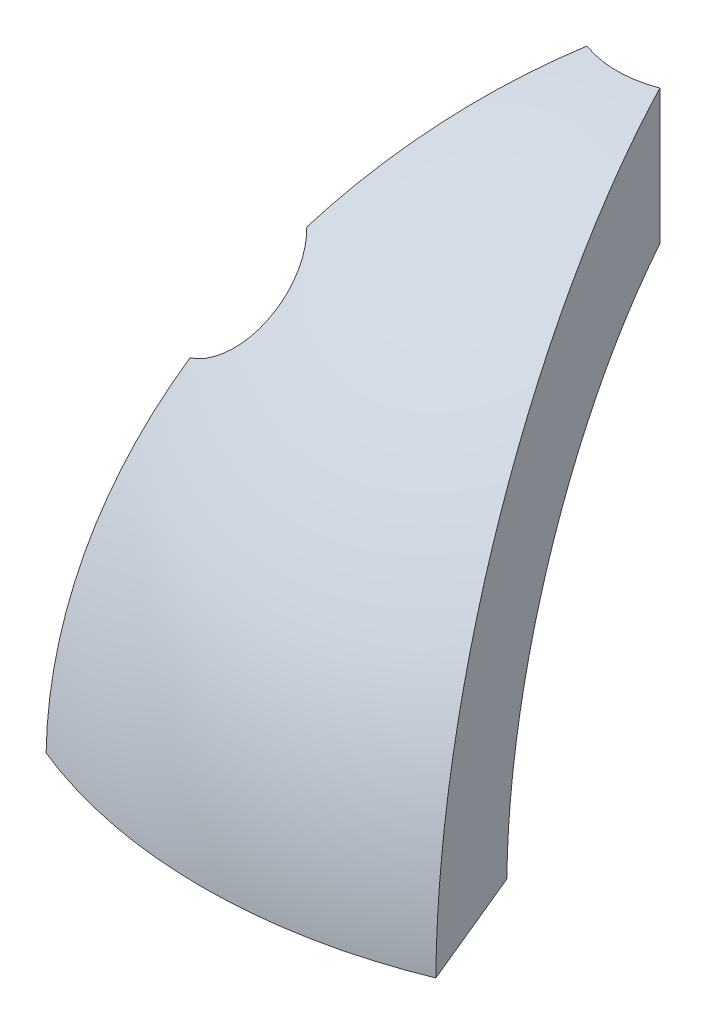
from build123d import *

# Parameters (mm, degrees)
REVOLVE1_ANGLE          = 45
CUT_EXTRUDE1_DEPTH      = 28.647117169
CUT_EXTRUDE1_DEPTH_BACK = 28.647117169
CUT_EXTRUDE4_START      = 8.537277035
CUT_EXTRUDE4_DEPTH      = 5.473576564
CUT_EXTRUDE4_START_2    = 14.010853599
CUT_EXTRUDE4_2_DEPTH    = 0.589178544
CUT_EXTRUDE5_DEPTH      = 28.732730484
CUT_EXTRUDE5_DEPTH_BACK = 28.732730484
SKETCH9_R               = 2.6035


with BuildPart() as part:
    # Sketch1 → Revolve1 (revolve, symmetric)
    with BuildSketch(Plane(origin=(0, 0, 0), x_dir=(0, 0, -1), z_dir=(1, 0, 0))) as revolve1_sk:
        with BuildLine():
            Line((-14.217802221, 0.25), (-19.048359509, 0.25))
            ThreePointArc((-19.048359509, 0.25), (-14.676690222, 12.144845166), (-3.81, 18.66511184))
            Line((-3.81, 18.66511184), (-3.81, 13.700083941))
            ThreePointArc((-3.81, 13.700083941), (-11.246181696, 8.70240181), (-14.217802221, 0.25))
        make_face()
    revolve(axis=Axis((0, 0, 0), (0, 1, 0)), revolution_arc=REVOLVE1_ANGLE / 2)
    revolve(revolve1_sk.sketch, axis=Axis((0, 0, 0), (0, -1, 0)), revolution_arc=REVOLVE1_ANGLE / 2)

    # Sketch2 → Cut-Extrude1 (cut, two sides: drawn at the far end of the back side and taken through both)
    with BuildSketch(Plane(origin=(0, 0, 0), x_dir=(1, 0, 0), z_dir=(0, 1, 0)).offset(-CUT_EXTRUDE1_DEPTH_BACK)):
        with BuildLine():
            Line((7.289491598, -17.598389479), (1.458023877, -3.519981019))
            ThreePointArc((1.458023877, -3.519981019), (1.400077392, -3.543428184), (1.341754023, -3.5659215))
            Line((1.341754023, -3.5659215), (7.173849701, -17.645845983))
            ThreePointArc((7.173849701, -17.645845983), (7.231709577, -17.622212591), (7.289491598, -17.598389479))
        make_face()
        with BuildLine():
            Line((-7.173849701, -17.645845983), (-1.341754023, -3.5659215))
            ThreePointArc((-1.341754023, -3.5659215), (-1.400077392, -3.543428184), (-1.458023877, -3.519981019))
            Line((-1.458023877, -3.519981019), (-7.289491598, -17.598389479))
            ThreePointArc((-7.289491598, -17.598389479), (-7.231709577, -17.622212591), (-7.173849701, -17.645845983))
        make_face()
    extrude(amount=CUT_EXTRUDE1_DEPTH + CUT_EXTRUDE1_DEPTH_BACK, mode=Mode.SUBTRACT)

    # Cut-Extrude4: read off the stored shape, not the designer's step
    # Cut-Extrude4 outline → Cut-Extrude4 (cut)
    with BuildSketch(Plane(origin=(0, 0, 0), x_dir=(-1, 0, 0), z_dir=(0, 0.3826834323650899, 0.9238795325112868)).offset(CUT_EXTRUDE4_START)):
        with BuildLine():
            add(Edge.make_bspline(
                [(1.145086138, 3.565969106), (1.19745992, 3.501753358), (1.247244242, 3.434878944), (1.289054738, 3.363552137), (1.36987604, 3.225674665), (1.42881214, 3.072360327), (1.457196317, 2.91577175), (1.47334903, 2.826661179), (1.4796055, 2.735818699), (1.481666667, 2.645269988)],
                knots=[0, 0, 0, 0, 0.246790042, 0.246790042, 0.246790042, 0.728901446, 0.728901446, 0.728901446, 1, 1, 1, 1], degree=3))
            add(Edge.make_bspline(
                [(-0.034726562, 4.053921831), (0.07575388, 4.051019144), (0.186778995, 4.046395579), (0.295874255, 4.028901651), (0.467443739, 4.001389693), (0.637906375, 3.946400478), (0.789002935, 3.861831747), (0.924097327, 3.786219427), (1.04145298, 3.67986749), (1.145086138, 3.565969106)],
                knots=[0, 0, 0, 0, 0.249295942, 0.249295942, 0.249295942, 0.645680683, 0.645680683, 0.645680683, 1, 1, 1, 1], degree=3))
            add(Edge.make_bspline(
                [(-1.538653846, 2.681777399), (-1.533984641, 2.841390676), (-1.509995079, 3.003784016), (-1.452444081, 3.153169647), (-1.394735889, 3.302963304), (-1.308458263, 3.44367736), (-1.206069907, 3.568297055), (-1.117554458, 3.676031652), (-1.011064819, 3.772567587), (-0.891455892, 3.845919508), (-0.771642392, 3.919396885), (-0.636486792, 3.970759294), (-0.499275438, 4.003497061), (-0.34783736, 4.039629235), (-0.190448958, 4.050094147), (-0.034726562, 4.053921831)],
                knots=[0, 0, 0, 0, 0.213488165, 0.213488165, 0.213488165, 0.426876737, 0.426876737, 0.426876737, 0.611615857, 0.611615857, 0.611615857, 0.79654204, 0.79654204, 0.79654204, 1, 1, 1, 1], degree=3))
            add(Edge.make_bspline(
                [(-0.661585537, 1.463676438), (-0.899774904, 1.586484198), (-1.128226559, 1.734488753), (-1.451046171, 2.153494958), (-1.532392107, 2.415727364), (-1.538653846, 2.681777399)],
                knots=[0, 0, 0, 0, 0.5, 0.5, 1, 1, 1, 1], degree=3))
            add(Edge.make_bspline(
                [(-1.310705128, 0.521607127), (-1.305904516, 0.65367332), (-1.280862157, 0.788593254), (-1.226377368, 0.909035745), (-1.178829711, 1.014143213), (-1.111903507, 1.112084922), (-1.032368876, 1.195678848), (-0.952782866, 1.279326774), (-0.859002662, 1.350529079), (-0.759375758, 1.408896603), (-0.727137868, 1.427783528), (-0.694356407, 1.445732495), (-0.661585537, 1.463676438)],
                knots=[0, 0, 0, 0, 0.332551925, 0.332551925, 0.332551925, 0.620515921, 0.620515921, 0.620515921, 0.907833434, 0.907833434, 0.907833434, 1, 1, 1, 1], degree=3))
            add(Edge.make_bspline(
                [(-0.008013822, -0.619026887), (-0.329093033, -0.609182757), (-0.647556074, -0.51508889), (-1.142511109, -0.108023215), (-1.296474915, 0.197661831), (-1.310705128, 0.521607127)],
                knots=[0, 0, 0, 0, 0.5, 0.5, 1, 1, 1, 1], degree=3))
            add(Edge.make_bspline(
                [(1.253717949, 0.534073073), (1.248106847, 0.402186726), (1.226592659, 0.268072734), (1.177956097, 0.145346109), (1.129145328, 0.022179899), (1.058406248, -0.094576574), (0.970426594, -0.19366506), (0.885346609, -0.289487746), (0.783549843, -0.372494682), (0.672886827, -0.437179025), (0.555024512, -0.506071477), (0.425013252, -0.557408464), (0.291775846, -0.587329089), (0.19373517, -0.609345716), (0.092421842, -0.615777022), (-0.008013822, -0.619026887)],
                knots=[0, 0, 0, 0, 0.21068445, 0.21068445, 0.21068445, 0.421636468, 0.421636468, 0.421636468, 0.625019757, 0.625019757, 0.625019757, 0.841526684, 0.841526684, 0.841526684, 1, 1, 1, 1], degree=3))
            add(Edge.make_bspline(
                [(0.622406851, 1.463676438), (0.794872438, 1.366288738), (0.958485385, 1.250710522), (1.193364369, 0.930775301), (1.246147584, 0.733258349), (1.253717949, 0.534073073)],
                knots=[0, 0, 0, 0, 0.5, 0.5, 1, 1, 1, 1], degree=3))
            add(Edge.make_bspline(
                [(1.481666667, 2.645269988), (1.477900568, 2.506257325), (1.458307011, 2.364648218), (1.409828968, 2.234085494), (1.360959813, 2.102469417), (1.284712252, 1.978252529), (1.189539786, 1.874109185), (1.068614249, 1.741785305), (0.920513154, 1.632246696), (0.764629517, 1.541288113), (0.718017874, 1.514090075), (0.670244168, 1.488815415), (0.622406851, 1.463676438)],
                knots=[0, 0, 0, 0, 0.272687597, 0.272687597, 0.272687597, 0.548164245, 0.548164245, 0.548164245, 0.896722367, 0.896722367, 0.896722367, 1, 1, 1, 1], degree=3))
        make_face()
        with BuildLine():
            add(Edge.make_bspline(
                [(-0.030274439, -0.163129452), (0.176574569, -0.158842716), (0.390032776, -0.127065887), (0.726671431, 0.112992678), (0.84816771, 0.307402482), (0.854807692, 0.518935853)],
                knots=[0, 0, 0, 0, 0.5, 0.5, 1, 1, 1, 1], degree=3))
            add(Edge.make_bspline(
                [(-0.911794872, 0.5278401), (-0.910378196, 0.461413058), (-0.899959463, 0.394094746), (-0.877901666, 0.331432281), (-0.855739467, 0.268473225), (-0.820498486, 0.209611521), (-0.778994043, 0.157340082), (-0.724231937, 0.088371705), (-0.655439967, 0.02939478), (-0.580836785, -0.017457561), (-0.506927182, -0.063874318), (-0.425458077, -0.100005398), (-0.341342733, -0.123398581), (-0.240648007, -0.151402628), (-0.134776636, -0.160365623), (-0.030274439, -0.163129452)],
                knots=[0, 0, 0, 0, 0.160427029, 0.160427029, 0.160427029, 0.321911318, 0.321911318, 0.321911318, 0.535779581, 0.535779581, 0.535779581, 0.747081473, 0.747081473, 0.747081473, 1, 1, 1, 1], degree=3))
            add(Edge.make_bspline(
                [(-0.014246795, 1.261550036), (-0.131042531, 1.258899944), (-0.250301822, 1.242809941), (-0.35950973, 1.201320714), (-0.46932602, 1.159600356), (-0.572837351, 1.096294942), (-0.660664627, 1.018289451), (-0.726352616, 0.959947394), (-0.78704119, 0.893280481), (-0.831209505, 0.817346662), (-0.8635483, 0.761750061), (-0.888278804, 0.700506224), (-0.900975083, 0.637472986), (-0.908226779, 0.601470474), (-0.910366848, 0.564534058), (-0.911794872, 0.5278401)],
                knots=[0, 0, 0, 0, 0.277542706, 0.277542706, 0.277542706, 0.556244576, 0.556244576, 0.556244576, 0.763368873, 0.763368873, 0.763368873, 0.914507238, 0.914507238, 0.914507238, 1, 1, 1, 1], degree=3))
            add(Edge.make_bspline(
                [(0.854807692, 0.518935853), (0.851059403, 0.598014432), (0.837417497, 0.678612401), (0.806387963, 0.751464013), (0.775422194, 0.824165914), (0.7336594, 0.89322838), (0.683069938, 0.953947492), (0.624552137, 1.024182453), (0.551669227, 1.083890883), (0.472635772, 1.129864493), (0.378451012, 1.18465159), (0.273659741, 1.22422906), (0.166691144, 1.244996806), (0.107237369, 1.256539642), (0.046291764, 1.259782899), (-0.014246795, 1.261550036)],
                knots=[0, 0, 0, 0, 0.190004067, 0.190004067, 0.190004067, 0.377891327, 0.377891327, 0.377891327, 0.596386864, 0.596386864, 0.596386864, 0.85665725, 0.85665725, 0.85665725, 1, 1, 1, 1], degree=3))
        make_face(mode=Mode.SUBTRACT)
        with BuildLine():
            add(Edge.make_bspline(
                [(-0.004452123, 1.717447472), (0.132632023, 1.720491033), (0.272405968, 1.738369237), (0.40113931, 1.784614637), (0.530887425, 1.831224577), (0.652811922, 1.904568261), (0.756086449, 1.994555749), (0.848976601, 2.075494889), (0.931308921, 2.1720404), (0.988858248, 2.280069612), (1.034817886, 2.366343142), (1.066797145, 2.462204933), (1.077073442, 2.559176199), (1.080385662, 2.590431638), (1.081573452, 2.621891168), (1.08275641, 2.65328381)],
                knots=[0, 0, 0, 0, 0.258744787, 0.258744787, 0.258744787, 0.519906858, 0.519906858, 0.519906858, 0.75422633, 0.75422633, 0.75422633, 0.940929049, 0.940929049, 0.940929049, 1, 1, 1, 1], degree=3))
            add(Edge.make_bspline(
                [(-1.13974359, 2.69513377), (-1.136169754, 2.59050849), (-1.120505423, 2.483937307), (-1.082652756, 2.386143186), (-1.044603899, 2.287842196), (-0.98671476, 2.195774251), (-0.917191359, 2.115830308), (-0.83143774, 2.017223475), (-0.727870947, 1.93048768), (-0.61293256, 1.866430444), (-0.501217868, 1.804169832), (-0.376661899, 1.760583309), (-0.250098152, 1.738548265), (-0.169177452, 1.724459783), (-0.086637973, 1.718909751), (-0.004452123, 1.717447472)],
                knots=[0, 0, 0, 0, 0.192044482, 0.192044482, 0.192044482, 0.384877418, 0.384877418, 0.384877418, 0.622856126, 0.622856126, 0.622856126, 0.853849591, 0.853849591, 0.853849591, 1, 1, 1, 1], degree=3))
            add(Edge.make_bspline(
                [(-0.030274439, 3.598024395), (-0.298573697, 3.591863177), (-0.570919773, 3.536651882), (-1.003008436, 3.218062583), (-1.127994918, 2.961046631), (-1.13974359, 2.69513377)],
                knots=[0, 0, 0, 0, 0.5, 0.5, 1, 1, 1, 1], degree=3))
            add(Edge.make_bspline(
                [(1.08275641, 2.65328381), (1.080255845, 2.755933686), (1.064947857, 2.860435386), (1.028329484, 2.956666448), (0.991574424, 3.053256715), (0.936196487, 3.144358219), (0.868885383, 3.223519144), (0.802139825, 3.30201496), (0.723848366, 3.373124744), (0.635864809, 3.427749398), (0.540657955, 3.486858642), (0.434210654, 3.530809684), (0.324977495, 3.557527657), (0.209271231, 3.585828924), (0.088905226, 3.595709256), (-0.030274439, 3.598024395)],
                knots=[0, 0, 0, 0, 0.192546627, 0.192546627, 0.192546627, 0.385457207, 0.385457207, 0.385457207, 0.576178648, 0.576178648, 0.576178648, 0.782445059, 0.782445059, 0.782445059, 1, 1, 1, 1], degree=3))
        make_face(mode=Mode.SUBTRACT)
    extrude(amount=CUT_EXTRUDE4_DEPTH, mode=Mode.SUBTRACT)

    # Cut-Extrude4 2 outline → Cut-Extrude4 2 (cut)
    with BuildSketch(Plane(origin=(0, 0, 0), x_dir=(1, 0, 0), z_dir=(0, 0.38268343236508984, 0.9238795325112867)).offset(CUT_EXTRUDE4_START_2)):
        with BuildLine():
            add(Edge.make_bspline(
                [(-1.145086138, -3.565969106), (-1.19745992, -3.501753358), (-1.247244242, -3.434878944), (-1.289054738, -3.363552137), (-1.36987604, -3.225674665), (-1.42881214, -3.072360327), (-1.457196317, -2.91577175), (-1.47334903, -2.826661179), (-1.4796055, -2.735818699), (-1.481666667, -2.645269988)],
                knots=[0, 0, 0, 0, 0.246790042, 0.246790042, 0.246790042, 0.728901446, 0.728901446, 0.728901446, 1, 1, 1, 1], degree=3))
            add(Edge.make_bspline(
                [(0.034726562, -4.053921831), (-0.07575388, -4.051019144), (-0.186778995, -4.046395579), (-0.295874255, -4.028901651), (-0.467443739, -4.001389693), (-0.637906375, -3.946400478), (-0.789002935, -3.861831747), (-0.924097327, -3.786219427), (-1.04145298, -3.67986749), (-1.145086138, -3.565969106)],
                knots=[0, 0, 0, 0, 0.249295942, 0.249295942, 0.249295942, 0.645680683, 0.645680683, 0.645680683, 1, 1, 1, 1], degree=3))
            add(Edge.make_bspline(
                [(1.538653846, -2.681777399), (1.533984641, -2.841390676), (1.509995079, -3.003784016), (1.452444081, -3.153169647), (1.394735889, -3.302963304), (1.308458263, -3.44367736), (1.206069907, -3.568297055), (1.117554458, -3.676031652), (1.011064819, -3.772567587), (0.891455892, -3.845919508), (0.771642392, -3.919396885), (0.636486792, -3.970759294), (0.499275438, -4.003497061), (0.34783736, -4.039629235), (0.190448958, -4.050094147), (0.034726562, -4.053921831)],
                knots=[0, 0, 0, 0, 0.213488165, 0.213488165, 0.213488165, 0.426876737, 0.426876737, 0.426876737, 0.611615857, 0.611615857, 0.611615857, 0.79654204, 0.79654204, 0.79654204, 1, 1, 1, 1], degree=3))
            add(Edge.make_bspline(
                [(0.661585537, -1.463676438), (0.899774904, -1.586484198), (1.128226559, -1.734488753), (1.451046171, -2.153494958), (1.532392107, -2.415727364), (1.538653846, -2.681777399)],
                knots=[0, 0, 0, 0, 0.5, 0.5, 1, 1, 1, 1], degree=3))
            add(Edge.make_bspline(
                [(1.310705128, -0.521607127), (1.305904516, -0.65367332), (1.280862157, -0.788593254), (1.226377368, -0.909035745), (1.178829711, -1.014143213), (1.111903507, -1.112084922), (1.032368876, -1.195678848), (0.952782866, -1.279326774), (0.859002662, -1.350529079), (0.759375758, -1.408896603), (0.727137868, -1.427783528), (0.694356407, -1.445732495), (0.661585537, -1.463676438)],
                knots=[0, 0, 0, 0, 0.332551925, 0.332551925, 0.332551925, 0.620515921, 0.620515921, 0.620515921, 0.907833434, 0.907833434, 0.907833434, 1, 1, 1, 1], degree=3))
            add(Edge.make_bspline(
                [(0.008013822, 0.619026887), (0.329093033, 0.609182757), (0.647556074, 0.51508889), (1.142511109, 0.108023215), (1.296474915, -0.197661831), (1.310705128, -0.521607127)],
                knots=[0, 0, 0, 0, 0.5, 0.5, 1, 1, 1, 1], degree=3))
            add(Edge.make_bspline(
                [(-1.253717949, -0.534073073), (-1.248106847, -0.402186726), (-1.226592659, -0.268072734), (-1.177956097, -0.145346109), (-1.129145328, -0.022179899), (-1.058406248, 0.094576574), (-0.970426594, 0.19366506), (-0.885346609, 0.289487746), (-0.783549843, 0.372494682), (-0.672886827, 0.437179025), (-0.555024512, 0.506071477), (-0.425013252, 0.557408464), (-0.291775846, 0.587329089), (-0.19373517, 0.609345716), (-0.092421842, 0.615777022), (0.008013822, 0.619026887)],
                knots=[0, 0, 0, 0, 0.21068445, 0.21068445, 0.21068445, 0.421636468, 0.421636468, 0.421636468, 0.625019757, 0.625019757, 0.625019757, 0.841526684, 0.841526684, 0.841526684, 1, 1, 1, 1], degree=3))
            add(Edge.make_bspline(
                [(-0.622406851, -1.463676438), (-0.794872438, -1.366288738), (-0.958485385, -1.250710522), (-1.193364369, -0.930775301), (-1.246147584, -0.733258349), (-1.253717949, -0.534073073)],
                knots=[0, 0, 0, 0, 0.5, 0.5, 1, 1, 1, 1], degree=3))
            add(Edge.make_bspline(
                [(-1.481666667, -2.645269988), (-1.477900568, -2.506257325), (-1.458307011, -2.364648218), (-1.409828968, -2.234085494), (-1.360959813, -2.102469417), (-1.284712252, -1.978252529), (-1.189539786, -1.874109185), (-1.068614249, -1.741785305), (-0.920513154, -1.632246696), (-0.764629517, -1.541288113), (-0.718017874, -1.514090075), (-0.670244168, -1.488815415), (-0.622406851, -1.463676438)],
                knots=[0, 0, 0, 0, 0.272687597, 0.272687597, 0.272687597, 0.548164245, 0.548164245, 0.548164245, 0.896722367, 0.896722367, 0.896722367, 1, 1, 1, 1], degree=3))
        make_face()
        with BuildLine():
            add(Edge.make_bspline(
                [(0.004452123, -1.717447472), (-0.132632023, -1.720491033), (-0.272405968, -1.738369237), (-0.40113931, -1.784614637), (-0.530887425, -1.831224577), (-0.652811922, -1.904568261), (-0.756086449, -1.994555749), (-0.848976601, -2.075494889), (-0.931308921, -2.1720404), (-0.988858248, -2.280069612), (-1.034817886, -2.366343142), (-1.066797145, -2.462204933), (-1.077073442, -2.559176199), (-1.080385662, -2.590431638), (-1.081573452, -2.621891168), (-1.08275641, -2.65328381)],
                knots=[0, 0, 0, 0, 0.258744787, 0.258744787, 0.258744787, 0.519906858, 0.519906858, 0.519906858, 0.75422633, 0.75422633, 0.75422633, 0.940929049, 0.940929049, 0.940929049, 1, 1, 1, 1], degree=3))
            add(Edge.make_bspline(
                [(1.13974359, -2.69513377), (1.136169754, -2.59050849), (1.120505423, -2.483937307), (1.082652756, -2.386143186), (1.044603899, -2.287842196), (0.98671476, -2.195774251), (0.917191359, -2.115830308), (0.83143774, -2.017223475), (0.727870947, -1.93048768), (0.61293256, -1.866430444), (0.501217868, -1.804169832), (0.376661899, -1.760583309), (0.250098152, -1.738548265), (0.169177452, -1.724459783), (0.086637973, -1.718909751), (0.004452123, -1.717447472)],
                knots=[0, 0, 0, 0, 0.192044482, 0.192044482, 0.192044482, 0.384877418, 0.384877418, 0.384877418, 0.622856126, 0.622856126, 0.622856126, 0.853849591, 0.853849591, 0.853849591, 1, 1, 1, 1], degree=3))
            add(Edge.make_bspline(
                [(0.030274439, -3.598024395), (0.298573697, -3.591863177), (0.570919773, -3.536651882), (1.003008436, -3.218062583), (1.127994918, -2.961046631), (1.13974359, -2.69513377)],
                knots=[0, 0, 0, 0, 0.5, 0.5, 1, 1, 1, 1], degree=3))
            add(Edge.make_bspline(
                [(-1.08275641, -2.65328381), (-1.080255845, -2.755933686), (-1.064947857, -2.860435386), (-1.028329484, -2.956666448), (-0.991574424, -3.053256715), (-0.936196487, -3.144358219), (-0.868885383, -3.223519144), (-0.802139825, -3.30201496), (-0.723848366, -3.373124744), (-0.635864809, -3.427749398), (-0.540657955, -3.486858642), (-0.434210654, -3.530809684), (-0.324977495, -3.557527657), (-0.209271231, -3.585828924), (-0.088905226, -3.595709256), (0.030274439, -3.598024395)],
                knots=[0, 0, 0, 0, 0.192546627, 0.192546627, 0.192546627, 0.385457207, 0.385457207, 0.385457207, 0.576178648, 0.576178648, 0.576178648, 0.782445059, 0.782445059, 0.782445059, 1, 1, 1, 1], degree=3))
        make_face(mode=Mode.SUBTRACT)
        with BuildLine():
            add(Edge.make_bspline(
                [(0.030274439, 0.163129452), (-0.176574569, 0.158842716), (-0.390032776, 0.127065887), (-0.726671431, -0.112992678), (-0.84816771, -0.307402482), (-0.854807692, -0.518935853)],
                knots=[0, 0, 0, 0, 0.5, 0.5, 1, 1, 1, 1], degree=3))
            add(Edge.make_bspline(
                [(0.911794872, -0.5278401), (0.910378196, -0.461413058), (0.899959463, -0.394094746), (0.877901666, -0.331432281), (0.855739467, -0.268473225), (0.820498486, -0.209611521), (0.778994043, -0.157340082), (0.724231937, -0.088371705), (0.655439967, -0.02939478), (0.580836785, 0.017457561), (0.506927182, 0.063874318), (0.425458077, 0.100005398), (0.341342733, 0.123398581), (0.240648007, 0.151402628), (0.134776636, 0.160365623), (0.030274439, 0.163129452)],
                knots=[0, 0, 0, 0, 0.160427029, 0.160427029, 0.160427029, 0.321911318, 0.321911318, 0.321911318, 0.535779581, 0.535779581, 0.535779581, 0.747081473, 0.747081473, 0.747081473, 1, 1, 1, 1], degree=3))
            add(Edge.make_bspline(
                [(0.014246795, -1.261550036), (0.131042531, -1.258899944), (0.250301822, -1.242809941), (0.35950973, -1.201320714), (0.46932602, -1.159600356), (0.572837351, -1.096294942), (0.660664627, -1.018289451), (0.726352616, -0.959947394), (0.78704119, -0.893280481), (0.831209505, -0.817346662), (0.8635483, -0.761750061), (0.888278804, -0.700506224), (0.900975083, -0.637472986), (0.908226779, -0.601470474), (0.910366848, -0.564534058), (0.911794872, -0.5278401)],
                knots=[0, 0, 0, 0, 0.277542706, 0.277542706, 0.277542706, 0.556244576, 0.556244576, 0.556244576, 0.763368873, 0.763368873, 0.763368873, 0.914507238, 0.914507238, 0.914507238, 1, 1, 1, 1], degree=3))
            add(Edge.make_bspline(
                [(-0.854807692, -0.518935853), (-0.851059403, -0.598014432), (-0.837417497, -0.678612401), (-0.806387963, -0.751464013), (-0.775422194, -0.824165914), (-0.7336594, -0.89322838), (-0.683069938, -0.953947492), (-0.624552137, -1.024182453), (-0.551669227, -1.083890883), (-0.472635772, -1.129864493), (-0.378451012, -1.18465159), (-0.273659741, -1.22422906), (-0.166691144, -1.244996806), (-0.107237369, -1.256539642), (-0.046291764, -1.259782899), (0.014246795, -1.261550036)],
                knots=[0, 0, 0, 0, 0.190004067, 0.190004067, 0.190004067, 0.377891327, 0.377891327, 0.377891327, 0.596386864, 0.596386864, 0.596386864, 0.85665725, 0.85665725, 0.85665725, 1, 1, 1, 1], degree=3))
        make_face(mode=Mode.SUBTRACT)
    extrude(amount=CUT_EXTRUDE4_2_DEPTH, mode=Mode.SUBTRACT)

    # Cut-Extrude4 3 outline → Cut-Extrude4 3 (revolve)
    with BuildSketch(Plane(origin=(0, 0, 0), x_dir=(1, 0, 0), z_dir=(0, -0.9238795325112867, 0.38268343236508984))):
        with BuildLine():
            ThreePointArc((0.162359306, 14.600073087), (2.128700501, 14.440766505), (4.054070901, 14.010853599))
            Line((4.054070901, 14.010853599), (4.054070901, 14.600073087))
            Line((4.054070901, 14.600073087), (0.162359306, 14.600073087))
        make_face()
    revolve(axis=Axis((0, 0, 0), (0, 0.38268343236508984, 0.9238795325112867)))

    # Sketch9 → Cut-Extrude5 (cut, two sides: drawn at the far end of the back side and taken through both)
    with BuildSketch(Plane(origin=(-8.561597025, 18.858537854, 16.803080265), x_dir=(-0.947072496207715, -0.23968096505676023, -0.21355730358933597), z_dir=(0.3210197609601124, -0.7071067811865475, -0.6300367553350459)).offset(-CUT_EXTRUDE5_DEPTH_BACK)):
        Circle(SKETCH9_R)
    extrude(amount=CUT_EXTRUDE5_DEPTH + CUT_EXTRUDE5_DEPTH_BACK, mode=Mode.SUBTRACT)


solid = part.part
